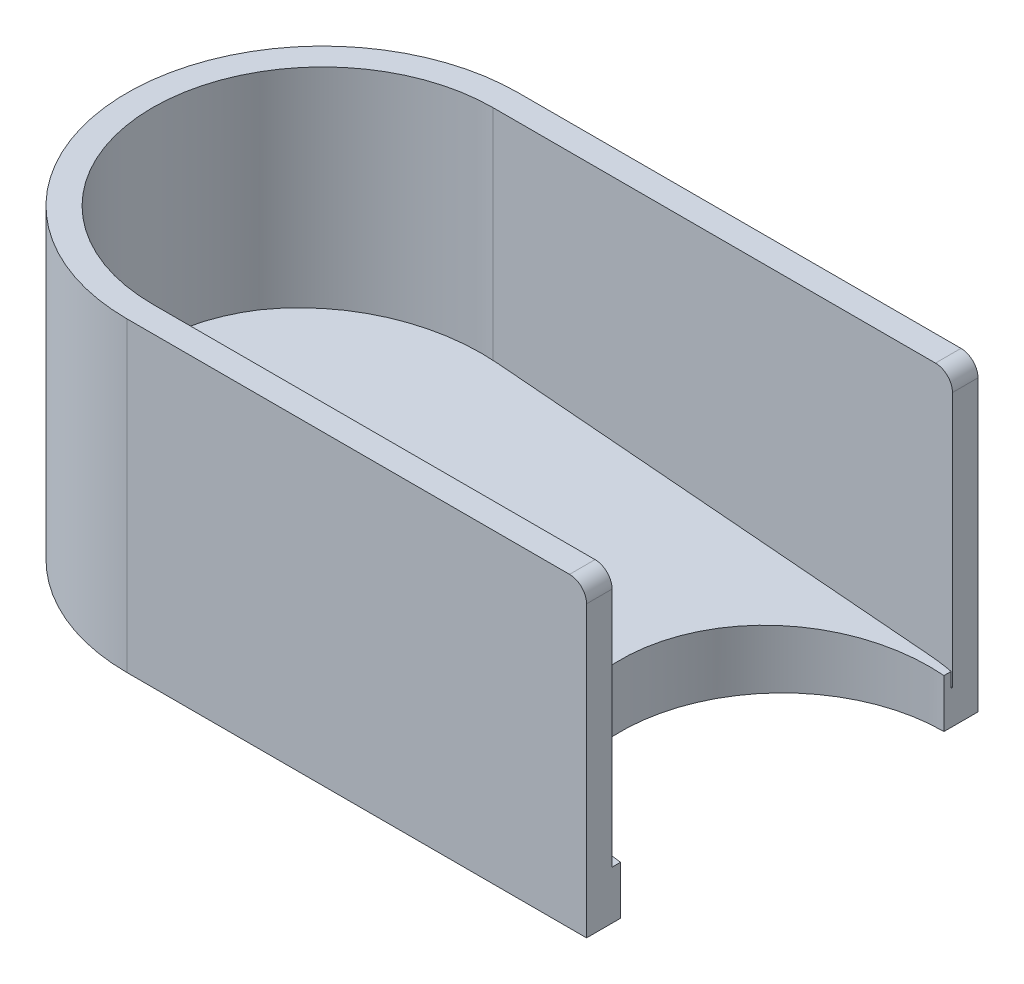
from build123d import *

# Parameters (mm, degrees)
MAIN_BODY_DEPTH      = 18
SLOT_CUT_DEPTH       = 16
RAMP_DEPTH           = 10
SKETCH9_W            = 54.817087741
SKETCH9_H            = 31.789175072
FLAT_BASE_DEPTH      = 10
EXIT_2_R             = 9.5
EXIT_HOLE_DEPTH      = 10
ATTACH_R             = 2.56
ATTACH_POINT_DEPTH   = 4
SKETCH10_W           = 24.987205092
SKETCH10_H           = 19.87431164
CORRECTION_CUT_DEPTH = 15
SMOOTH_EDGES_R       = 1


with BuildPart() as part:
    # Sketch3 → Main Body (new body)
    with BuildSketch(Plane(origin=(0, 0, 0), x_dir=(1, 0, 0), z_dir=(0, 1, 0))):
        with BuildLine():
            Line((-13.5, 11.5), (13.5, 11.5))
            ThreePointArc((13.5, 11.5), (25, 0), (13.5, -11.5))
            Line((13.5, -11.5), (-13.5, -11.5))
            ThreePointArc((-13.5, -11.5), (-25, 0), (-13.5, 11.5))
        make_face()
    extrude(amount=MAIN_BODY_DEPTH)

    # Sketch4 → Slot Cut (cut)
    with BuildSketch(Plane(origin=(0, 18, 0), x_dir=(1, 0, 0), z_dir=(0, 1, 0))):
        with BuildLine():
            Line((-13.5, 10), (13.5, 10))
            ThreePointArc((13.5, 10), (23.5, 0), (13.5, -10))
            Line((13.5, -10), (-13.5, -10))
            ThreePointArc((-13.5, -10), (-23.5, 0), (-13.5, 10))
        make_face()
    extrude(amount=-SLOT_CUT_DEPTH, mode=Mode.SUBTRACT)

    # Sketch7 → Ramp (add)
    with BuildSketch(Plane(origin=(0.337977528, 3.971235955, 0), x_dir=(0.9963980072059784, -0.08479983040050883, 0), z_dir=(0.08479983040050883, 0.9963980072059784, 0))):
        with BuildLine():
            Line((-13.620972758, 10), (11.92497615, 10))
            ThreePointArc((11.92497615, 10), (22.448141558, -0.523165408), (11.92497615, -11.046330815))
            Line((11.92497615, -11.046330815), (-13.620972758, -11.046330815))
            ThreePointArc((-13.620972758, -11.046330815), (-24.144138166, -0.523165408), (-13.620972758, 10))
        make_face()
    extrude(amount=-RAMP_DEPTH)

    # Sketch9 → Flat Base (cut)
    with BuildSketch(Plane(origin=(0, 0, 0), x_dir=(1, 0, 0), z_dir=(0, 1, 0))):
        with Locations((0.350611631, 0.686867089)):
            Rectangle(SKETCH9_W, SKETCH9_H)
    extrude(amount=-FLAT_BASE_DEPTH, mode=Mode.SUBTRACT)

    # Exit 2 → Exit Hole (cut)
    with BuildSketch(Plane.XZ):
        with Locations((13.5, 0)):
            Circle(EXIT_2_R)
    extrude(amount=-EXIT_HOLE_DEPTH, mode=Mode.SUBTRACT)

    # Attach → Attach point (cut)
    with BuildSketch(Plane.XZ):
        with Locations((-13.5, 0)):
            Circle(ATTACH_R)
    extrude(amount=-ATTACH_POINT_DEPTH, mode=Mode.SUBTRACT)

    # Sketch10 → Correction Cut (cut)
    with BuildSketch(Plane.ZY.offset(-13.5)):
        with Locations((-0.270929181, 8.591341698)):
            Rectangle(SKETCH10_W, SKETCH10_H)
    extrude(amount=-CORRECTION_CUT_DEPTH, mode=Mode.SUBTRACT)

    # Smooth Edges
    smooth_edges_edges = [part.edges().sort_by_distance(p)[0] for p in [
        (13.5, 18, -10.75),
        (13.5, 18, 10.75),
    ]]
    fillet(smooth_edges_edges, radius=SMOOTH_EDGES_R)


solid = part.part
